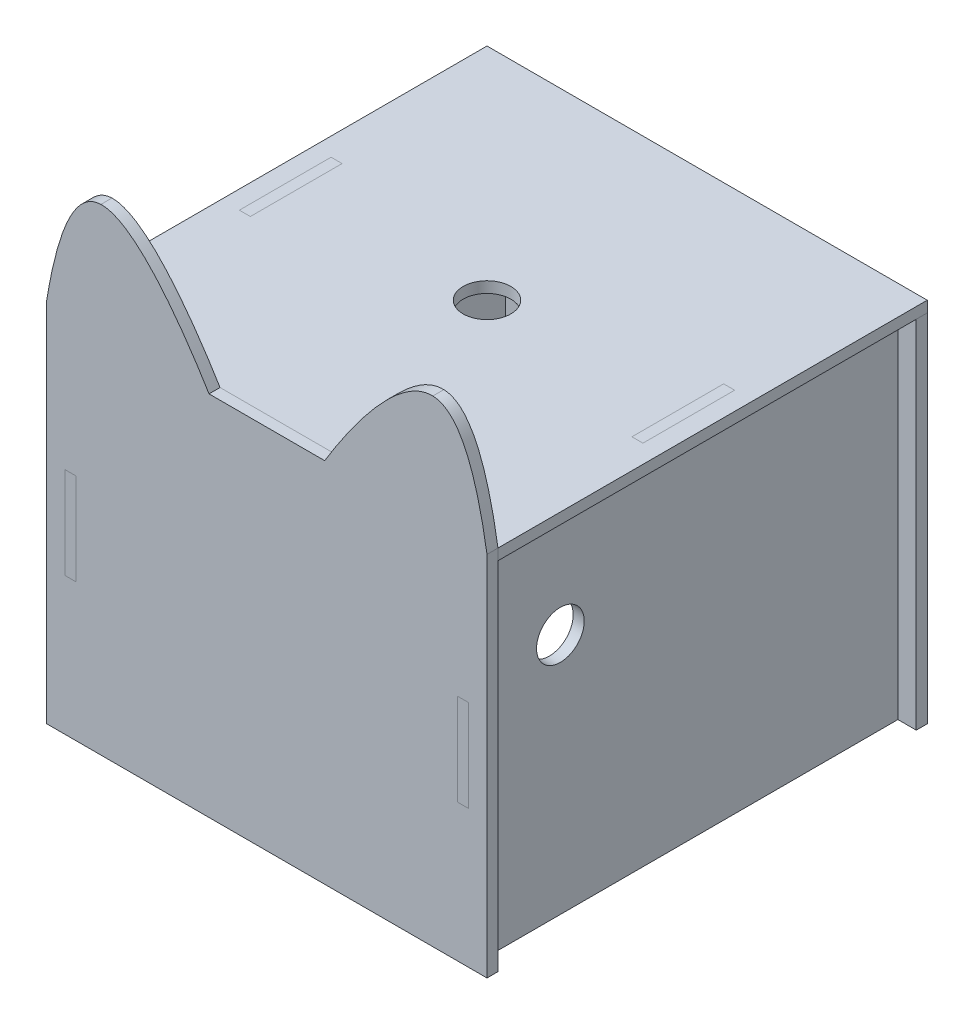
from build123d import *

# Parameters (mm, degrees)
SALIENTE_EXTRUIR1_START = 60
SALIENTE_EXTRUIR1_DEPTH = 3
SALIENTE_EXTRUIR2_START = -60
CROQUIS2_W              = 120
CROQUIS2_H              = 100
SALIENTE_EXTRUIR2_DEPTH = 3
SALIENTE_EXTRUIR3_START = -8
SALIENTE_EXTRUIR3_DEPTH = 3
CROQUIS4_W              = 119.999849
CROQUIS4_H              = 117
SALIENTE_EXTRUIR4_DEPTH = 3
CROQUIS5_W              = 3
CROQUIS5_H              = 25
CORTAR_EXTRUIR1_DEPTH   = 187.815418903
MOVER_CARA1_BY          = 3
CROQUIS7_W              = 3
CROQUIS7_H              = 25
CORTAR_EXTRUIR2_DEPTH   = 132.14880797
CROQUIS8_R              = 6.5
CORTAR_EXTRUIR3_DEPTH   = 3
CROQUIS9_R              = 6.5
CORTAR_EXTRUIR4_DEPTH   = 184.643678769
CROQUIS10_R             = 6.5
CORTAR_EXTRUIR5_DEPTH   = 3


# Read off the part's stored shape, not the designer's step: Saliente-Extruir3
with BuildPart() as part:
    # Model → Saliente-Extruir1 (new body)
    with BuildSketch(Plane.XY.offset(SALIENTE_EXTRUIR1_START)):
        with BuildLine():
            Line((15.764688, 100.00011), (-15.764828, 100.00011))
            add(Edge.make_bspline(
                [(-15.764828, 100.00011), (-21.400806, 109.325085), (-35.208529, 130.297372), (-45.229888, 129.996806)],
                knots=[0, 0, 0, 0, 1, 1, 1, 1], degree=3))
            add(Edge.make_bspline(
                [(-45.229888, 129.996806), (-55.17293, 129.698356), (-59.999989, 100.00011)],
                knots=[0, 0, 0, 1, 1, 1], degree=2))
            Line((-59.999989, 100.00011), (-59.999989, -4.9e-05))
            Line((-59.999989, -4.9e-05), (59.999849, -4.9e-05))
            Line((59.999849, -4.9e-05), (59.999849, 100.00011))
            add(Edge.make_bspline(
                [(59.999849, 100.00011), (55.17279, 129.698356), (45.229748, 129.996806)],
                knots=[0, 0, 0, 1, 1, 1], degree=2))
            add(Edge.make_bspline(
                [(45.229748, 129.996806), (35.208389, 130.297372), (21.401019, 109.325085), (15.764688, 100.00011)],
                knots=[0, 0, 0, 0, 1, 1, 1, 1], degree=3))
        make_face()
    extrude(amount=-SALIENTE_EXTRUIR1_DEPTH)


with BuildPart() as body_2:
    # Croquis2 → Saliente-Extruir2 (new body)
    with BuildSketch(Plane.XY.offset(SALIENTE_EXTRUIR2_START)):
        with Locations((0, 50)):
            Rectangle(CROQUIS2_W, CROQUIS2_H)
    extrude(amount=SALIENTE_EXTRUIR2_DEPTH)


with BuildPart() as body_3:
    # Saliente-Extruir3 outline → Saliente-Extruir3 (new body)
    with BuildSketch(Plane(origin=(60, 0, 0), x_dir=(0, 0, -1), z_dir=(1, 0, 0)).offset(SALIENTE_EXTRUIR3_START)):
        Polygon((-57, 62.4999755), (-60, 62.4999755), (-60, 37.4999755), (-57, 37.4999755), (-57, -4.9e-05), (57, -4.9e-05), (57, 37.4999755), (60, 37.4999755), (60, 62.4999755), (57, 62.4999755), (57, 97), (12.5, 97), (12.5, 100), (-12.5, 100), (-12.5, 97), (-57, 97), align=None)
    extrude(amount=SALIENTE_EXTRUIR3_DEPTH)


with BuildPart() as body_4:
    # Simetría2: mirrored copy
    add(body_3.part.mirror(Plane(origin=(0, 0, 0), x_dir=(0, 0, 1), z_dir=(1, 0, 0))))


with BuildPart() as body_5:
    # Croquis4 → Saliente-Extruir4 (new body)
    with BuildSketch(Plane(origin=(0, 100, 0), x_dir=(1, 0, 0), z_dir=(0, 1, 0))):
        with Locations((-7.55e-05, 1.5)):
            Rectangle(CROQUIS4_W, CROQUIS4_H)
    extrude(amount=-SALIENTE_EXTRUIR4_DEPTH)

    # Croquis7 → Cortar-Extruir2 (cut, through all)
    with BuildSketch(Plane(origin=(0, 100, 0), x_dir=(1, 0, 0), z_dir=(0, 1, 0))):
        with Locations((-53.5, 0)):
            Rectangle(CROQUIS7_W, CROQUIS7_H)
        with Locations((53.5, 0)):
            Rectangle(CROQUIS7_W, CROQUIS7_H)
    extrude(amount=-CORTAR_EXTRUIR2_DEPTH, mode=Mode.SUBTRACT)

    # Croquis10 → Cortar-Extruir5 (cut)
    with BuildSketch(Plane(origin=(0, 100, 0), x_dir=(1, 0, 0), z_dir=(0, 1, 0))):
        with Locations(Location((0, 0, 0), (0, 0, 270))):
            Circle(CROQUIS10_R)
    extrude(amount=-CORTAR_EXTRUIR5_DEPTH, mode=Mode.SUBTRACT)


with BuildPart() as cortar_extruir1_tool:
    # Croquis5 → Cortar-Extruir1 (new, through all)
    with BuildSketch(Plane.XY.offset(60)):
        with Locations((-53.5, 49.9999755)):
            Rectangle(CROQUIS5_W, CROQUIS5_H)
        with Locations((53.5, 49.9999755)):
            Rectangle(CROQUIS5_W, CROQUIS5_H)
    extrude(amount=-CORTAR_EXTRUIR1_DEPTH)


with BuildPart() as part_1:
    add(part.part)

    # Cortar-Extruir1: cut by cortar_extruir1_tool
    add(cortar_extruir1_tool.part, mode=Mode.SUBTRACT)


with BuildPart() as body_2_1:
    add(body_2.part)

    # Cortar-Extruir1: cut by cortar_extruir1_tool
    add(cortar_extruir1_tool.part, mode=Mode.SUBTRACT)

    # Mover cara1: a face moved inward by 3.0
    extrude(body_2_1.faces().sort_by_distance((0, 100, -58.5))[0], amount=MOVER_CARA1_BY, dir=(0, -1, 0), mode=Mode.SUBTRACT)

    # Croquis8 → Cortar-Extruir3 (cut)
    with BuildSketch(Plane(origin=(0, 0, -60), x_dir=(-1, 0, 0), z_dir=(0, 0, -1))):
        with Locations((0, 81.5)):
            Circle(CROQUIS8_R)
    extrude(amount=-CORTAR_EXTRUIR3_DEPTH, mode=Mode.SUBTRACT)


with BuildPart() as cortar_extruir4_tool:
    # Croquis9 → Cortar-Extruir4 (new, through all)
    with BuildSketch(Plane(origin=(55, 0, 0), x_dir=(0, 0, -1), z_dir=(1, 0, 0))):
        with Locations(Location((-35, 66, 0), (0, 0, 180))):
            Circle(CROQUIS9_R)
    extrude(amount=-CORTAR_EXTRUIR4_DEPTH)


with BuildPart() as body_3_1:
    add(body_3.part)

    # Cortar-Extruir4: cut by cortar_extruir4_tool
    add(cortar_extruir4_tool.part, mode=Mode.SUBTRACT)


with BuildPart() as body_4_1:
    add(body_4.part)

    # Cortar-Extruir4: cut by cortar_extruir4_tool
    add(cortar_extruir4_tool.part, mode=Mode.SUBTRACT)


solid = Compound([body_5.part, part_1.part, body_2_1.part, body_3_1.part, body_4_1.part])
